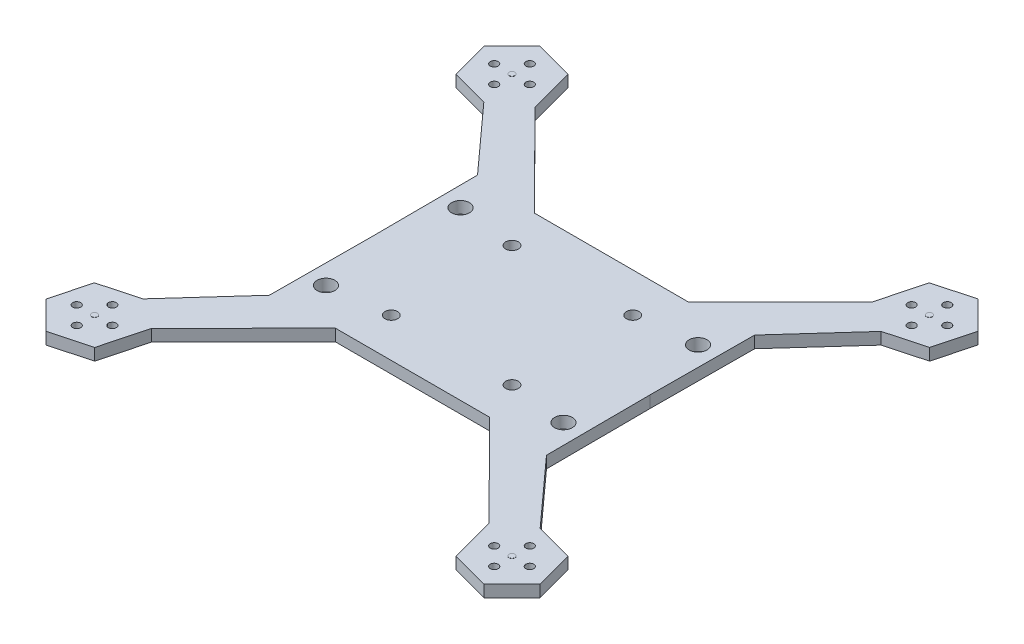
from build123d import *

# Parameters (mm, degrees)
SKETCH1_R           = 1
SKETCH1_R_2         = 2.25
SKETCH1_R_3         = 1.6
BOSS_EXTRUDE1_DEPTH = 3
SKETCH4_R           = 6.495043718
SKETCH4_R_2         = 4.9
BOSS_EXTRUDE3_DEPTH = 5
SKETCH6_W           = 8.48311055
SKETCH6_H           = 1.891574962
CUT_EXTRUDE3_DEPTH  = 34
SKETCH7_R           = 0.75
BOSS_EXTRUDE4_DEPTH = 0.05


with BuildPart() as part:
    # Sketch1 → Boss-Extrude1 (new body)
    with BuildSketch(Plane(origin=(0, 0, 0), x_dir=(1, 0, 0), z_dir=(0, 1, 0))):
        Polygon((43.076410298, 50.123925917), (42.618597625, 48.402115535), (19.4637773, 25.158118275), (-19.4637773, 25.158118275), (-42.618597625, 48.402115535), (-45.64603124, 59.788140743), (-55.300297258, 62.394891143), (-62.384942335, 55.337426715), (-59.815321393, 45.673211889), (-50.185022628, 43.072932893), (-35, 26.288270568), (-34.873, 0), (-35, -26.288270568), (-50.185022628, -43.072932893), (-59.815321393, -45.673211889), (-62.384942335, -55.337426715), (-55.300297258, -62.394891143), (-45.64603124, -59.788140743), (-42.618597625, -48.402115535), (-19.4637773, -25.158118275), (19.4637773, -25.158118275), (42.618597625, -48.402115535), (45.64603124, -59.788140743), (55.300297258, -62.394891143), (62.384942335, -55.337426715), (59.815321393, -45.673211889), (50.185022628, -43.072932893), (35, -26.288270568), (34.873, 0), (35, 26.288270568), (50.185022628, 43.072932893), (59.815321393, 45.673211889), (62.384942335, 55.337426715), (55.300297258, 62.394891143), (45.64603124, 59.788140743), align=None)
        with Locations((-52.730676316, -57.230676316)):
            Circle(SKETCH1_R, mode=Mode.SUBTRACT)
        with Locations((-57.230676316, -52.730676316)):
            Circle(SKETCH1_R, mode=Mode.SUBTRACT)
        with Locations((-48.230676316, -52.730676316)):
            Circle(SKETCH1_R, mode=Mode.SUBTRACT)
        with Locations((-52.730676316, -48.230676316)):
            Circle(SKETCH1_R, mode=Mode.SUBTRACT)
        with Locations((-30, -17)):
            Circle(SKETCH1_R_2, mode=Mode.SUBTRACT)
        with Locations((-15.25, -15.25)):
            Circle(SKETCH1_R_3, mode=Mode.SUBTRACT)
        with Locations((52.730676316, -57.230676316)):
            Circle(SKETCH1_R, mode=Mode.SUBTRACT)
        with Locations((48.230676316, -52.730676316)):
            Circle(SKETCH1_R, mode=Mode.SUBTRACT)
        with Locations((52.730676316, -48.230676316)):
            Circle(SKETCH1_R, mode=Mode.SUBTRACT)
        with Locations((57.230676316, -52.730676316)):
            Circle(SKETCH1_R, mode=Mode.SUBTRACT)
        with Locations((30, -17)):
            Circle(SKETCH1_R_2, mode=Mode.SUBTRACT)
        with Locations((15.25, -15.25)):
            Circle(SKETCH1_R_3, mode=Mode.SUBTRACT)
        with Locations((-15.25, 15.25)):
            Circle(SKETCH1_R_3, mode=Mode.SUBTRACT)
        with Locations((-30, 17)):
            Circle(SKETCH1_R_2, mode=Mode.SUBTRACT)
        with Locations((-57.230676316, 52.730676316)):
            Circle(SKETCH1_R, mode=Mode.SUBTRACT)
        with Locations((-52.730676316, 48.230676316)):
            Circle(SKETCH1_R, mode=Mode.SUBTRACT)
        with Locations((-48.230676316, 52.730676316)):
            Circle(SKETCH1_R, mode=Mode.SUBTRACT)
        with Locations((-52.730676316, 57.230676316)):
            Circle(SKETCH1_R, mode=Mode.SUBTRACT)
        with Locations((15.25, 15.25)):
            Circle(SKETCH1_R_3, mode=Mode.SUBTRACT)
        with Locations((30, 17)):
            Circle(SKETCH1_R_2, mode=Mode.SUBTRACT)
        with Locations((52.730676316, 48.230676316)):
            Circle(SKETCH1_R, mode=Mode.SUBTRACT)
        with Locations((48.230676316, 52.730676316)):
            Circle(SKETCH1_R, mode=Mode.SUBTRACT)
        with Locations((57.230676316, 52.730676316)):
            Circle(SKETCH1_R, mode=Mode.SUBTRACT)
        with Locations((52.730676316, 57.230676316)):
            Circle(SKETCH1_R, mode=Mode.SUBTRACT)
    extrude(amount=BOSS_EXTRUDE1_DEPTH)

    # Sketch4 → Boss-Extrude3 (add)
    with BuildSketch(Plane.XZ):
        Circle(SKETCH4_R)
        Circle(SKETCH4_R_2, mode=Mode.SUBTRACT)
    extrude(amount=BOSS_EXTRUDE3_DEPTH)

    # Sketch6 → Cut-Extrude3 (cut)
    with BuildSketch(Plane.XY.offset(25.158118275)):
        with Locations((0, -0.945787481)):
            Rectangle(SKETCH6_W, SKETCH6_H)
    extrude(amount=-CUT_EXTRUDE3_DEPTH, mode=Mode.SUBTRACT)

    # Sketch7 → Boss-Extrude4 (add)
    with BuildSketch(Plane(origin=(0, 3, 0), x_dir=(1, 0, 0), z_dir=(0, 1, 0))):
        with Locations((-52.730676316, -52.730676316)):
            Circle(SKETCH7_R)
        with Locations((-52.730676316, 52.730676316)):
            Circle(SKETCH7_R)
        with Locations((52.730676316, 52.730676316)):
            Circle(SKETCH7_R)
        with Locations((52.730676316, -52.730676316)):
            Circle(SKETCH7_R)
    extrude(amount=BOSS_EXTRUDE4_DEPTH)


solid = part.part
